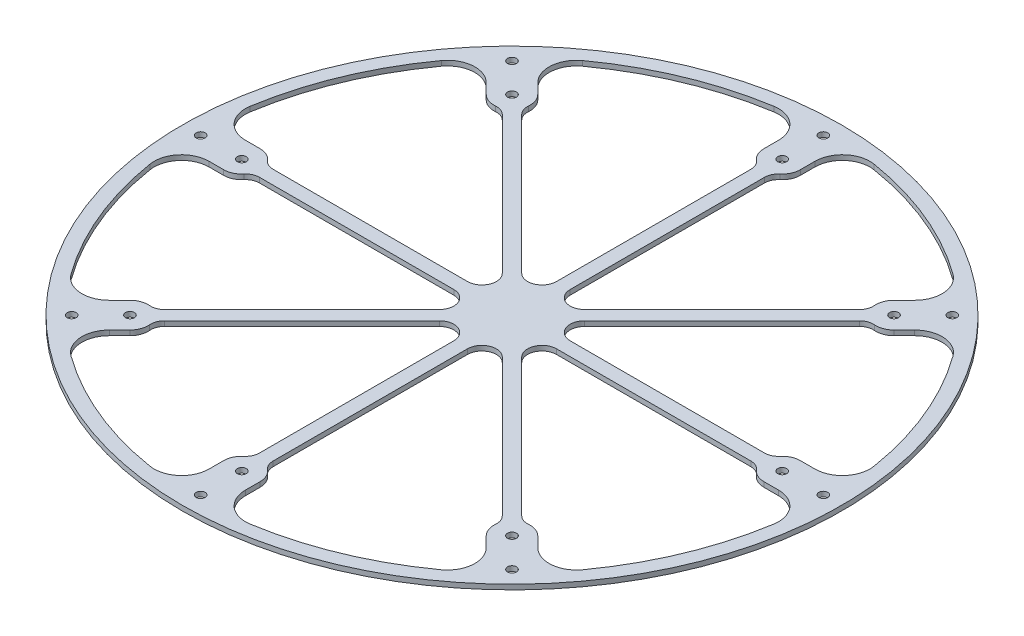
from build123d import *

# Parameters (mm, degrees)
SKETCH1_R           = 152.4
SKETCH1_R_2         = 2.070099999999984
SKETCH1_R_3         = 2.0700999999999827
SKETCH1_R_4         = 2.070099999999987
SKETCH1_R_5         = 2.0700999999999805
SKETCH1_R_6         = 2.070099999999982
SKETCH1_R_7         = 2.070099999999981
SKETCH1_R_8         = 2.07009999999998
SKETCH1_R_9         = 2.0700999999999787
SKETCH1_R_10        = 2.070099999999999
SKETCH1_R_11        = 2.070099999999978
SKETCH1_R_12        = 2.0700999999999765
SKETCH1_R_13        = 2.0700999999999934
SKETCH1_R_14        = 2.0700999999999747
BOSS_EXTRUDE1_DEPTH = 2.286
CUT_EXTRUDE1_DEPTH  = 216.53826991047322
CIRPATTERN1_COUNT   = 8
FILLET1_R           = 6.35


with BuildPart() as part:
    # Sketch1 → Boss-Extrude1 (new body)
    with BuildSketch(Plane(origin=(0, 0, 0), x_dir=(1, 0, 0), z_dir=(0, 1, 0))):
        Circle(SKETCH1_R)
        with Locations((-143.9799, 1.749e-14)):
            Circle(SKETCH1_R_2, mode=Mode.SUBTRACT)
        with Locations((-124.9299, -1.53e-14)):
            Circle(SKETCH1_R_3, mode=Mode.SUBTRACT)
        with Locations((-101.8091636445608, 101.80916364456118)):
            Circle(SKETCH1_R_4, mode=Mode.SUBTRACT)
        with Locations((-88.33877946295712, 88.33877946295739)):
            Circle(SKETCH1_R_5, mode=Mode.SUBTRACT)
        with Locations((5.202e-13, 143.9799)):
            Circle(SKETCH1_R_6, mode=Mode.SUBTRACT)
        with Locations((4.2089e-13, 124.9299)):
            Circle(SKETCH1_R_7, mode=Mode.SUBTRACT)
        with Locations((101.80916364456154, 101.80916364456044)):
            Circle(SKETCH1_R_4, mode=Mode.SUBTRACT)
        with Locations((88.3387794629577, 88.33877946295681)):
            Circle(SKETCH1_R_5, mode=Mode.SUBTRACT)
        with Locations((143.9799, -1.0229e-12)):
            Circle(SKETCH1_R_8, mode=Mode.SUBTRACT)
        with Locations((124.9299, -8.5708e-13)):
            Circle(SKETCH1_R_9, mode=Mode.SUBTRACT)
        with Locations((101.8091636445601, -101.80916364456186)):
            Circle(SKETCH1_R_10, mode=Mode.SUBTRACT)
        with Locations((88.33877946295651, -88.33877946295799)):
            Circle(SKETCH1_R_4, mode=Mode.SUBTRACT)
        with Locations((-1.5256e-12, -143.9799)):
            Circle(SKETCH1_R_11, mode=Mode.SUBTRACT)
        with Locations((-1.29327e-12, -124.9299)):
            Circle(SKETCH1_R_12, mode=Mode.SUBTRACT)
        with Locations((-101.80916364456223, -101.80916364455973)):
            Circle(SKETCH1_R_13, mode=Mode.SUBTRACT)
        with Locations((-88.3387794629583, -88.3387794629562)):
            Circle(SKETCH1_R_14, mode=Mode.SUBTRACT)
    extrude(amount=BOSS_EXTRUDE1_DEPTH)

    # Sketch2 → Cut-Extrude1 (cut, through all)
    with BuildSketch(Plane(origin=(0, 2.286, 0), x_dir=(1, 0, 0), z_dir=(0, 1, 0))):
        with BuildLine():
            ThreePointArc((3.1750000000002516, -117.13134506911759), (6.986841257319973, -120.23073696228855), (8.420099999998719, -124.9299))
            Line((8.420099999998717, -124.9299), (8.420099999998637, -131.6668670394721))
            ThreePointArc((8.420099999998639, -131.6668670394721), (12.88163120444934, -141.3321467511392), (23.131538095236692, -144.2065686622791))
            ThreePointArc((23.13153809523673, -144.2065686622791), (55.89091529692152, -134.93260572327338), (85.61297514632435, -118.32591003915775))
            ThreePointArc((85.6129751463244, -118.32591003915772), (90.82823058997255, -109.04560814479298), (87.14862473293043, -99.05644434946592))
            Line((87.14862473293043, -99.05644434946592), (82.38486965468944, -94.29268927122504))
            ThreePointArc((82.38486965468765, -94.29268927122683), (80.07552658096357, -89.95641224521594), (80.5793043576061, -85.06943241814194))
            Line((80.57930435760602, -85.069432418142), (14.554814795987514, -19.044942856522383))
            ThreePointArc((14.554814795987514, -19.04494285652238), (11.14164107789032, -17.22056340123132), (7.290119914433424, -17.599904875685596))
            ThreePointArc((7.290119914433424, -17.599904875685596), (4.298447514577617, -20.055106641508246), (3.174999999999997, -23.758616482314267))
            Line((3.174999999999999, -23.758616482314267), (3.175, -117.13134506911767))
        make_face()
    cut_extrude1 = extrude(amount=-CUT_EXTRUDE1_DEPTH, mode=Mode.SUBTRACT)

    # CirPattern1: Cut-Extrude1 ×8 about axis
    cirpattern1_axis = Axis((0, 0, 0), (0, 1, 0))
    for i in range(1, CIRPATTERN1_COUNT):
        add(cut_extrude1.rotate(cirpattern1_axis, i * 360 / CIRPATTERN1_COUNT), mode=Mode.SUBTRACT)

    # Fillet1
    fillet1_edges = [part.edges().sort_by_distance(p)[0] for p in [
        (3.1750000000009493, 1.143, -117.13134506911688),
        (-3.1750000000001117, 1.143, -117.13134506911763),
        (-80.57930435760605, 1.143, -85.06943241814199),
        (-85.06943241814191, 1.143, -80.5793043576072),
        (-117.13134506911689, 1.143, -3.1750000000009564),
        (-117.13134506911763, 1.143, 3.1750000000000997),
        (-80.5793043576072, 1.143, 85.0694324181419),
        (-85.06943241814199, 1.143, 80.57930435760605),
        (-3.1750000000009706, 1.143, 117.13134506911686),
        (3.175000000000126, 1.143, 117.13134506911763),
        (85.06943241814191, 1.143, 80.57930435760719),
        (80.57930435760606, 1.143, 85.06943241814197),
        (117.13134506911688, 1.143, 3.1750000000009493),
        (117.13134506911763, 1.143, -3.175000000000113),
        (80.57930435760719, 1.143, -85.06943241814191),
        (85.06943241814199, 1.143, -80.57930435760605),
    ]]
    fillet(fillet1_edges, radius=FILLET1_R)


solid = part.part
